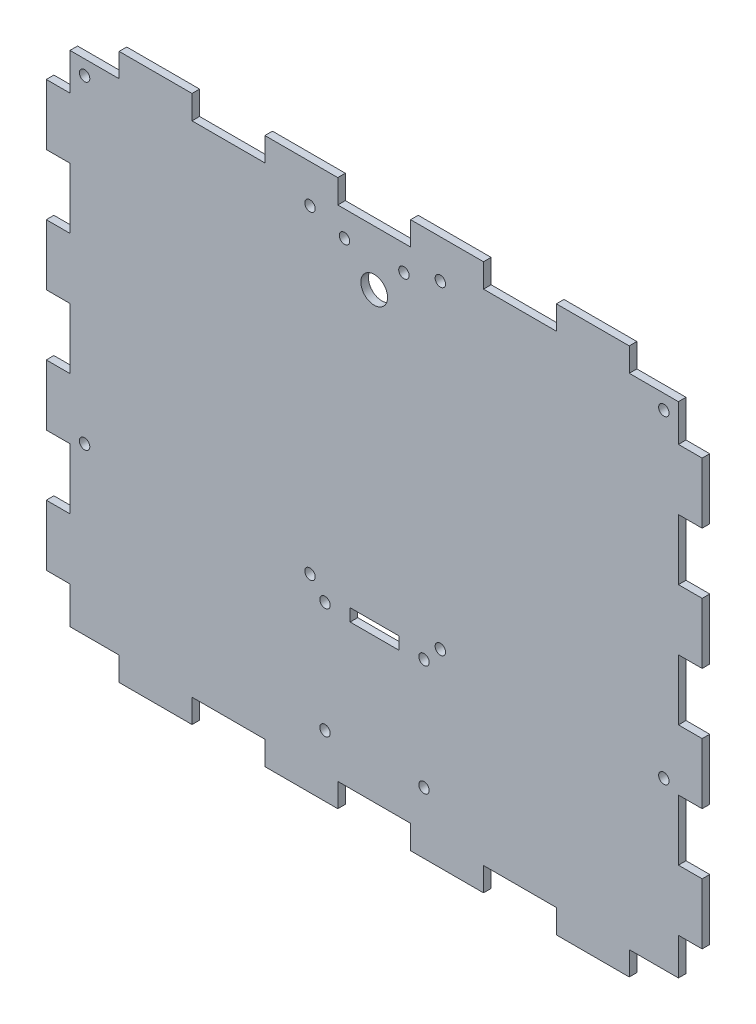
from build123d import *

# Parameters (mm, degrees)
SKETCH1_W               = 137.16
SKETCH1_H               = 114.3
BOSS_EXTRUDE1_DEPTH     = 1.5875
SKETCH2_R               = 2.794
CUT_EXTRUDE2_DEPTH      = 90.285267857
CAVITY7_START           = -68.58
CAVITY7_OUTLINE_W       = 4.9609375
CAVITY7_OUTLINE_H       = 1.5875
CAVITY7_DEPTH           = 15.24
CAVITY7_START_2         = -38.1
CAVITY7_2_OUTLINE_W     = 4.9609375
CAVITY7_2_OUTLINE_H     = 1.5875
CAVITY7_2_DEPTH         = 15.24
CAVITY7_START_3         = -7.62
CAVITY7_3_OUTLINE_W     = 4.9609375
CAVITY7_3_OUTLINE_H     = 1.5875
CAVITY7_3_DEPTH         = 15.24
CAVITY7_START_4         = 22.86
CAVITY7_4_OUTLINE_W     = 4.9609375
CAVITY7_4_OUTLINE_H     = 1.5875
CAVITY7_4_DEPTH         = 15.24
CAVITY7_START_5         = 53.34
CAVITY7_5_OUTLINE_W     = 4.9609375
CAVITY7_5_OUTLINE_H     = 1.5875
CAVITY7_5_DEPTH         = 15.24
CAVITY8_START           = -68.58
CAVITY8_OUTLINE_W       = 4.9609375
CAVITY8_OUTLINE_H       = 1.5875
CAVITY8_DEPTH           = 15.24
CAVITY8_START_2         = -38.1
CAVITY8_2_OUTLINE_W     = 4.9609375
CAVITY8_2_OUTLINE_H     = 1.5875
CAVITY8_2_DEPTH         = 15.24
CAVITY8_START_3         = -7.62
CAVITY8_3_OUTLINE_W     = 4.9609375
CAVITY8_3_OUTLINE_H     = 1.5875
CAVITY8_3_DEPTH         = 15.24
CAVITY8_START_4         = 22.86
CAVITY8_4_OUTLINE_W     = 4.9609375
CAVITY8_4_OUTLINE_H     = 1.5875
CAVITY8_4_DEPTH         = 15.24
CAVITY8_START_5         = 53.34
CAVITY8_5_OUTLINE_W     = 4.9609375
CAVITY8_5_OUTLINE_H     = 1.5875
CAVITY8_5_DEPTH         = 15.24
CAVITY9_START           = -68.58
CAVITY9_OUTLINE_W       = 7.7390625
CAVITY9_OUTLINE_H       = 1.5875
CAVITY9_OUTLINE_W_2     = 12.7
CAVITY9_DEPTH           = 4.9609375
CAVITY10_START          = -31.75
CAVITY10_OUTLINE_W      = 4.9609375
CAVITY10_OUTLINE_H      = 1.5875
CAVITY10_DEPTH          = 12.7
CAVITY10_START_2        = -6.35
CAVITY10_2_OUTLINE_W    = 4.9609375
CAVITY10_2_OUTLINE_H    = 1.5875
CAVITY10_2_DEPTH        = 12.7
CAVITY10_START_3        = 19.05
CAVITY10_3_OUTLINE_W    = 4.9609375
CAVITY10_3_OUTLINE_H    = 1.5875
CAVITY10_3_DEPTH        = 12.7
CAVITY10_START_4        = -52.1890625
CAVITY10_4_OUTLINE_W    = 4.9609375
CAVITY10_4_OUTLINE_H    = 1.5875
CAVITY10_4_DEPTH        = 7.7390625
CAVITY10_START_5        = 44.45
CAVITY10_5_OUTLINE_W    = 4.9609375
CAVITY10_5_OUTLINE_H    = 1.5875
CAVITY10_5_DEPTH        = 7.7390625
CUT_EXTRUDE6_DEPTH      = 90.285267857
CUT_EXTRUDE6_DEPTH_BACK = 90.285267857
SKETCH3_W               = 10.1854
SKETCH3_H               = 2.5908
SKETCH5_R               = 1.0922
CUT_EXTRUDE7_DEPTH      = 90.285267857
SKETCH6_R               = 1.0922
CUT_EXTRUDE8_DEPTH      = 90.285267857
SKETCH7_R               = 1.0922
CUT_EXTRUDE9_DEPTH      = 90.285267857
SKETCH8_R               = 1.0922
CUT_EXTRUDE10_DEPTH     = 90.285267857
SKETCH9_R               = 1.0922
CUT_EXTRUDE11_DEPTH     = 90.285267857
SKETCH10_R              = 1.0922
CUT_EXTRUDE12_DEPTH     = 90.285267857


# Read off the part's stored shape, not the designer's step: Cavity7, Cavity8, Cavity9, Cavity10
with BuildPart() as part:
    # Sketch1 → Boss-Extrude1 (new body)
    with BuildSketch(Plane.XY):
        Rectangle(SKETCH1_W, SKETCH1_H)
    extrude(amount=BOSS_EXTRUDE1_DEPTH)

    # Sketch2 → Cut-Extrude2 (cut, through all)
    with BuildSketch(Plane.XY.offset(1.5875)):
        with Locations((0, 40.64)):
            Circle(SKETCH2_R)
    extrude(amount=-CUT_EXTRUDE2_DEPTH, mode=Mode.SUBTRACT)

    # Cavity7 outline → Cavity7 (cut)
    with BuildSketch(Plane.YZ.offset(CAVITY7_START)):
        with Locations((-54.66953125, 0.79375)):
            Rectangle(CAVITY7_OUTLINE_W, CAVITY7_OUTLINE_H)
    extrude(amount=CAVITY7_DEPTH, mode=Mode.SUBTRACT)

    # Cavity7 2 outline → Cavity7 2 (cut)
    with BuildSketch(Plane.YZ.offset(CAVITY7_START_2)):
        with Locations((-54.66953125, 0.79375)):
            Rectangle(CAVITY7_2_OUTLINE_W, CAVITY7_2_OUTLINE_H)
    extrude(amount=CAVITY7_2_DEPTH, mode=Mode.SUBTRACT)

    # Cavity7 3 outline → Cavity7 3 (cut)
    with BuildSketch(Plane.YZ.offset(CAVITY7_START_3)):
        with Locations((-54.66953125, 0.79375)):
            Rectangle(CAVITY7_3_OUTLINE_W, CAVITY7_3_OUTLINE_H)
    extrude(amount=CAVITY7_3_DEPTH, mode=Mode.SUBTRACT)

    # Cavity7 4 outline → Cavity7 4 (cut)
    with BuildSketch(Plane.YZ.offset(CAVITY7_START_4)):
        with Locations((-54.66953125, 0.79375)):
            Rectangle(CAVITY7_4_OUTLINE_W, CAVITY7_4_OUTLINE_H)
    extrude(amount=CAVITY7_4_DEPTH, mode=Mode.SUBTRACT)

    # Cavity7 5 outline → Cavity7 5 (cut)
    with BuildSketch(Plane.YZ.offset(CAVITY7_START_5)):
        with Locations((-54.66953125, 0.79375)):
            Rectangle(CAVITY7_5_OUTLINE_W, CAVITY7_5_OUTLINE_H)
    extrude(amount=CAVITY7_5_DEPTH, mode=Mode.SUBTRACT)

    # Cavity8 outline → Cavity8 (cut)
    with BuildSketch(Plane.YZ.offset(CAVITY8_START)):
        with Locations((54.66953125, 0.79375)):
            Rectangle(CAVITY8_OUTLINE_W, CAVITY8_OUTLINE_H)
    extrude(amount=CAVITY8_DEPTH, mode=Mode.SUBTRACT)

    # Cavity8 2 outline → Cavity8 2 (cut)
    with BuildSketch(Plane.YZ.offset(CAVITY8_START_2)):
        with Locations((54.66953125, 0.79375)):
            Rectangle(CAVITY8_2_OUTLINE_W, CAVITY8_2_OUTLINE_H)
    extrude(amount=CAVITY8_2_DEPTH, mode=Mode.SUBTRACT)

    # Cavity8 3 outline → Cavity8 3 (cut)
    with BuildSketch(Plane.YZ.offset(CAVITY8_START_3)):
        with Locations((54.66953125, 0.79375)):
            Rectangle(CAVITY8_3_OUTLINE_W, CAVITY8_3_OUTLINE_H)
    extrude(amount=CAVITY8_3_DEPTH, mode=Mode.SUBTRACT)

    # Cavity8 4 outline → Cavity8 4 (cut)
    with BuildSketch(Plane.YZ.offset(CAVITY8_START_4)):
        with Locations((54.66953125, 0.79375)):
            Rectangle(CAVITY8_4_OUTLINE_W, CAVITY8_4_OUTLINE_H)
    extrude(amount=CAVITY8_4_DEPTH, mode=Mode.SUBTRACT)

    # Cavity8 5 outline → Cavity8 5 (cut)
    with BuildSketch(Plane.YZ.offset(CAVITY8_START_5)):
        with Locations((54.66953125, 0.79375)):
            Rectangle(CAVITY8_5_OUTLINE_W, CAVITY8_5_OUTLINE_H)
    extrude(amount=CAVITY8_5_DEPTH, mode=Mode.SUBTRACT)

    # Cavity9 outline → Cavity9 (cut)
    with BuildSketch(Plane.YZ.offset(CAVITY9_START)):
        with Locations((48.31953125, 0.79375)):
            Rectangle(CAVITY9_OUTLINE_W, CAVITY9_OUTLINE_H)
        with Locations((25.4, 0.79375)):
            Rectangle(CAVITY9_OUTLINE_W_2, CAVITY9_OUTLINE_H)
        with Locations((0, 0.79375)):
            Rectangle(CAVITY9_OUTLINE_W_2, CAVITY9_OUTLINE_H)
        with Locations((-25.4, 0.79375)):
            Rectangle(CAVITY9_OUTLINE_W_2, CAVITY9_OUTLINE_H)
        with Locations((-48.31953125, 0.79375)):
            Rectangle(CAVITY9_OUTLINE_W, CAVITY9_OUTLINE_H)
    extrude(amount=CAVITY9_DEPTH, mode=Mode.SUBTRACT)

    # Cavity10 outline → Cavity10 (cut)
    with BuildSketch(Plane(origin=(0, 0, 0), x_dir=(1, 0, 0), z_dir=(0, 1, 0)).offset(CAVITY10_START)):
        with Locations((66.09953125, -0.79375)):
            Rectangle(CAVITY10_OUTLINE_W, CAVITY10_OUTLINE_H)
    extrude(amount=CAVITY10_DEPTH, mode=Mode.SUBTRACT)

    # Cavity10 2 outline → Cavity10 2 (cut)
    with BuildSketch(Plane(origin=(0, 0, 0), x_dir=(1, 0, 0), z_dir=(0, 1, 0)).offset(CAVITY10_START_2)):
        with Locations((66.09953125, -0.79375)):
            Rectangle(CAVITY10_2_OUTLINE_W, CAVITY10_2_OUTLINE_H)
    extrude(amount=CAVITY10_2_DEPTH, mode=Mode.SUBTRACT)

    # Cavity10 3 outline → Cavity10 3 (cut)
    with BuildSketch(Plane(origin=(0, 0, 0), x_dir=(1, 0, 0), z_dir=(0, 1, 0)).offset(CAVITY10_START_3)):
        with Locations((66.09953125, -0.79375)):
            Rectangle(CAVITY10_3_OUTLINE_W, CAVITY10_3_OUTLINE_H)
    extrude(amount=CAVITY10_3_DEPTH, mode=Mode.SUBTRACT)

    # Cavity10 4 outline → Cavity10 4 (cut)
    with BuildSketch(Plane(origin=(0, 0, 0), x_dir=(1, 0, 0), z_dir=(0, 1, 0)).offset(CAVITY10_START_4)):
        with Locations((66.09953125, -0.79375)):
            Rectangle(CAVITY10_4_OUTLINE_W, CAVITY10_4_OUTLINE_H)
    extrude(amount=CAVITY10_4_DEPTH, mode=Mode.SUBTRACT)

    # Cavity10 5 outline → Cavity10 5 (cut)
    with BuildSketch(Plane(origin=(0, 0, 0), x_dir=(1, 0, 0), z_dir=(0, 1, 0)).offset(CAVITY10_START_5)):
        with Locations((66.09953125, -0.79375)):
            Rectangle(CAVITY10_5_OUTLINE_W, CAVITY10_5_OUTLINE_H)
    extrude(amount=CAVITY10_5_DEPTH, mode=Mode.SUBTRACT)

    # Sketch3 → Cut-Extrude6 (cut, two sides: drawn at the far end of the back side and taken through both)
    with BuildSketch(Plane.XY.offset(1.5875).offset(-CUT_EXTRUDE6_DEPTH_BACK)):
        with Locations((0.061, -20.75)):
            Rectangle(SKETCH3_W, SKETCH3_H)
    extrude(amount=CUT_EXTRUDE6_DEPTH + CUT_EXTRUDE6_DEPTH_BACK, mode=Mode.SUBTRACT)

    # Sketch5 → Cut-Extrude7 (cut, through all)
    with BuildSketch(Plane.XY.offset(1.5875)):
        with Locations((-10.289, -21.1)):
            Circle(SKETCH5_R)
    extrude(amount=-CUT_EXTRUDE7_DEPTH, mode=Mode.SUBTRACT)

    # Sketch6 → Cut-Extrude8 (cut, through all)
    with BuildSketch(Plane.XY.offset(1.5875)):
        with Locations((10.411, -21.1)):
            Circle(SKETCH6_R)
    extrude(amount=-CUT_EXTRUDE8_DEPTH, mode=Mode.SUBTRACT)

    # Sketch7 → Cut-Extrude9 (cut, through all)
    with BuildSketch(Plane.XY.offset(1.5875)):
        with Locations((10.411, -44.3)):
            Circle(SKETCH7_R)
    extrude(amount=-CUT_EXTRUDE9_DEPTH, mode=Mode.SUBTRACT)

    # Sketch8 → Cut-Extrude10 (cut, through all)
    with BuildSketch(Plane.XY.offset(1.5875)):
        with Locations((-10.289, -44.3)):
            Circle(SKETCH8_R)
    extrude(amount=-CUT_EXTRUDE10_DEPTH, mode=Mode.SUBTRACT)

    # Sketch9 → Cut-Extrude11 (cut, through all)
    with BuildSketch(Plane.XY.offset(1.5875)):
        with Locations((60.5710625, 49.1410625)):
            Circle(SKETCH9_R)
        with Locations((13.8350625, 49.1410625)):
            Circle(SKETCH9_R)
        with Locations((13.8350625, -17.5339375)):
            Circle(SKETCH9_R)
        with Locations((60.5710625, -17.5339375)):
            Circle(SKETCH9_R)
        with Locations((-13.4286625, 49.1410625)):
            Circle(SKETCH9_R)
        with Locations((-60.5710625, 49.1410625)):
            Circle(SKETCH9_R)
        with Locations((-60.5710625, -17.5339375)):
            Circle(SKETCH9_R)
        with Locations((-13.4286625, -17.5339375)):
            Circle(SKETCH9_R)
    extrude(amount=-CUT_EXTRUDE11_DEPTH, mode=Mode.SUBTRACT)

    # Sketch10 → Cut-Extrude12 (cut, through all)
    with BuildSketch(Plane.XY.offset(1.5875)):
        with Locations((-6.214337236, 46.854337236)):
            Circle(SKETCH10_R)
        with Locations((6.214337236, 46.854337236)):
            Circle(SKETCH10_R)
    extrude(amount=-CUT_EXTRUDE12_DEPTH, mode=Mode.SUBTRACT)


solid = part.part
